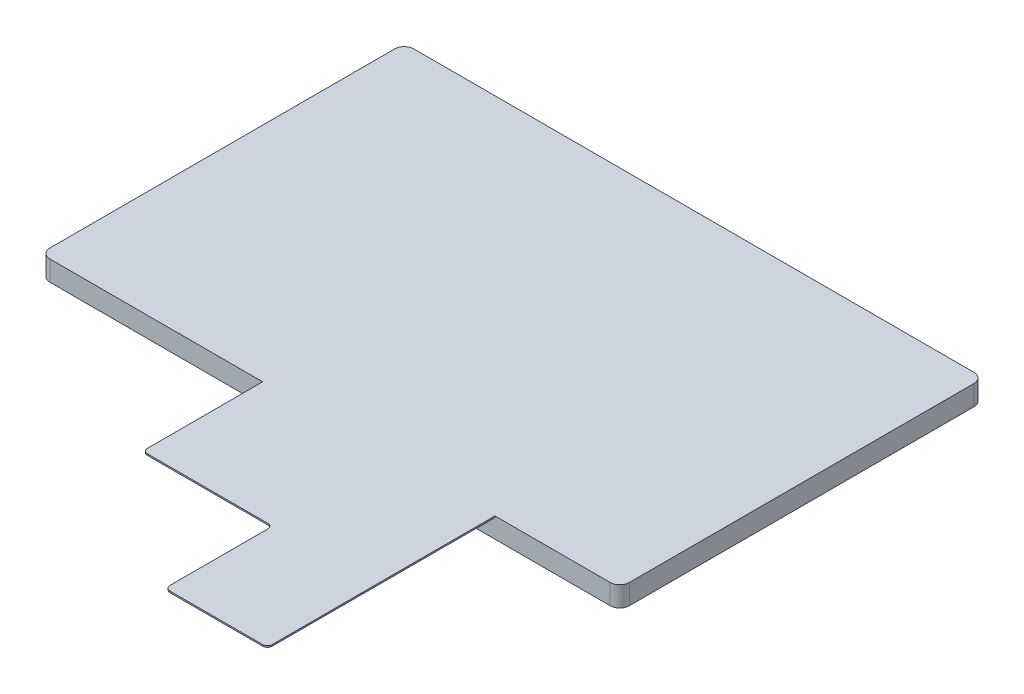
from build123d import *

# Parameters (mm, degrees)
SKETCH1_W           = 120.7
SKETCH1_H           = 75.8
BOSS_EXTRUDE1_DEPTH = 4.2
SKETCH2_W           = 48.4
SKETCH2_H           = 47.4
BOSS_EXTRUDE2_DEPTH = 0.3
SKETCH4_W           = 27.08
SKETCH4_H           = 22.41
CUT_EXTRUDE1_DEPTH  = 0.3
FILLET2_R           = 1
FILLET3_R           = 2


with BuildPart() as part:
    # Sketch1 → Boss-Extrude1 (new body)
    with BuildSketch(Plane(origin=(0, 0, 0), x_dir=(1, 0, 0), z_dir=(0, 1, 0))):
        with Locations((60.35, -37.9)):
            Rectangle(SKETCH1_W, SKETCH1_H)
    extrude(amount=BOSS_EXTRUDE1_DEPTH)

    # Sketch2 → Boss-Extrude2 (add)
    with BuildSketch(Plane(origin=(0, 4.2, 0), x_dir=(1, 0, 0), z_dir=(0, 1, 0))):
        with Locations((70.5, -99.5)):
            Rectangle(SKETCH2_W, SKETCH2_H)
    extrude(amount=-BOSS_EXTRUDE2_DEPTH)

    # Sketch4 → Cut-Extrude1 (cut)
    with BuildSketch(Plane.XZ.offset(-3.9)):
        with Locations((59.84, 111.995)):
            Rectangle(SKETCH4_W, SKETCH4_H)
    extrude(amount=-CUT_EXTRUDE1_DEPTH, mode=Mode.SUBTRACT)

    # Fillet2
    fillet2_edges = [part.edges().sort_by_distance(p)[0] for p in [
        (46.3, 4.05, 100.79),
        (73.38, 4.05, 100.79),
        (73.38, 4.05, 123.2),
        (94.7, 4.05, 123.2),
    ]]
    fillet(fillet2_edges, radius=FILLET2_R)

    # Fillet3
    fillet3_edges = [part.edges().sort_by_distance(p)[0] for p in [
        (120.7, 2.1, 75.8),
        (0, 2.1, 75.8),
        (120.7, 2.1, 0),
        (0, 2.1, 0),
    ]]
    fillet(fillet3_edges, radius=FILLET3_R)


solid = part.part
